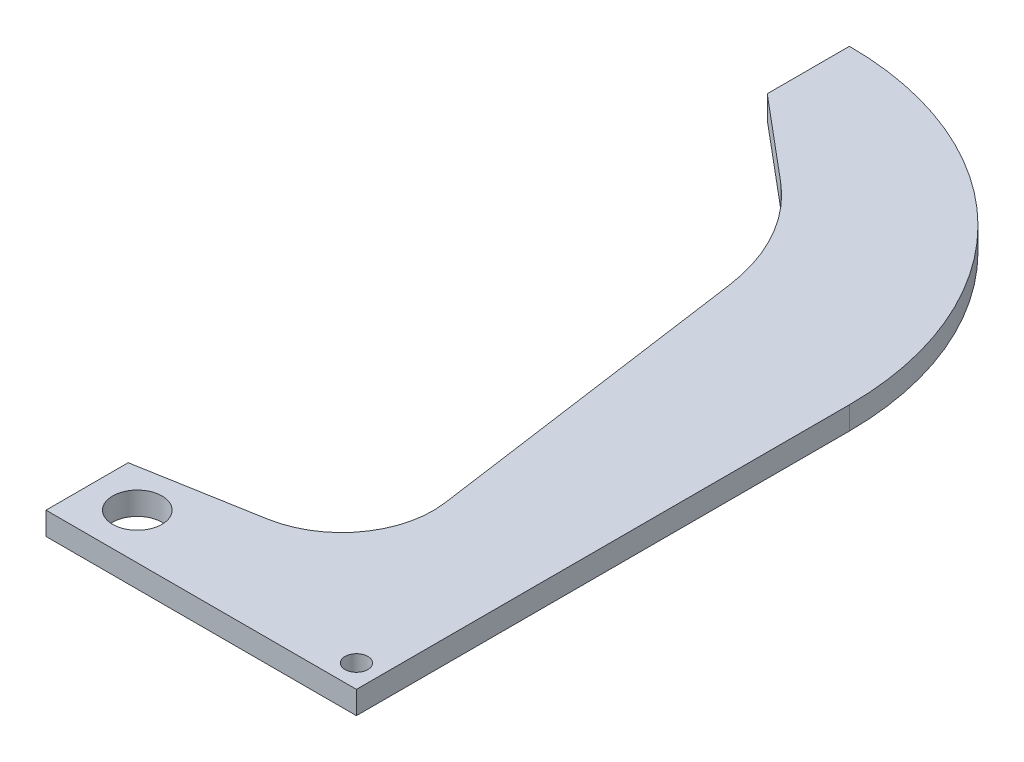
from build123d import *

# Parameters (mm, degrees)
SKETCH1_R           = 3.429
SKETCH1_R_2         = 1.5875
BOSS_EXTRUDE1_DEPTH = 3.175
CUT_EXTRUDE1_DEPTH  = 120.85362166


with BuildPart() as part:
    # Sketch1 → Boss-Extrude1 (new body)
    with BuildSketch(Plane(origin=(0, 0, 0), x_dir=(1, 0, 0), z_dir=(0, 1, 0))):
        with BuildLine():
            Line((0, 0), (43.18, 0))
            Line((43.18, 0), (43.18, 68.58))
            ThreePointArc((43.18, 68.58), (30.532870812, 99.112870812), (0, 111.76))
            Line((0, 111.76), (0, 0))
        make_face()
        with Locations((6.35, 6.35)):
            Circle(SKETCH1_R, mode=Mode.SUBTRACT)
        with Locations((40.005, 3.175)):
            Circle(SKETCH1_R_2, mode=Mode.SUBTRACT)
    extrude(amount=BOSS_EXTRUDE1_DEPTH)

    # Sketch2 → Cut-Extrude1 (cut, through all)
    with BuildSketch(Plane(origin=(0, 3.175, 0), x_dir=(1, 0, 0), z_dir=(0, 1, 0))):
        with BuildLine():
            Line((16.499594236, 14.339323634), (0, 11.43))
            Line((0, 11.43), (0, 100.33))
            Line((0, 100.33), (11.578626407, 90.614378852))
            ThreePointArc((11.578626407, 90.614378852), (17.468445655, 83.468697719), (20.405366763, 74.686600928))
            Line((20.405366763, 74.686600928), (26.8710352, 28.611257563))
            ThreePointArc((26.8710352, 28.611257563), (24.567999732, 19.380438031), (16.499594236, 14.339323634))
        make_face()
    extrude(amount=-CUT_EXTRUDE1_DEPTH, mode=Mode.SUBTRACT)


solid = part.part
